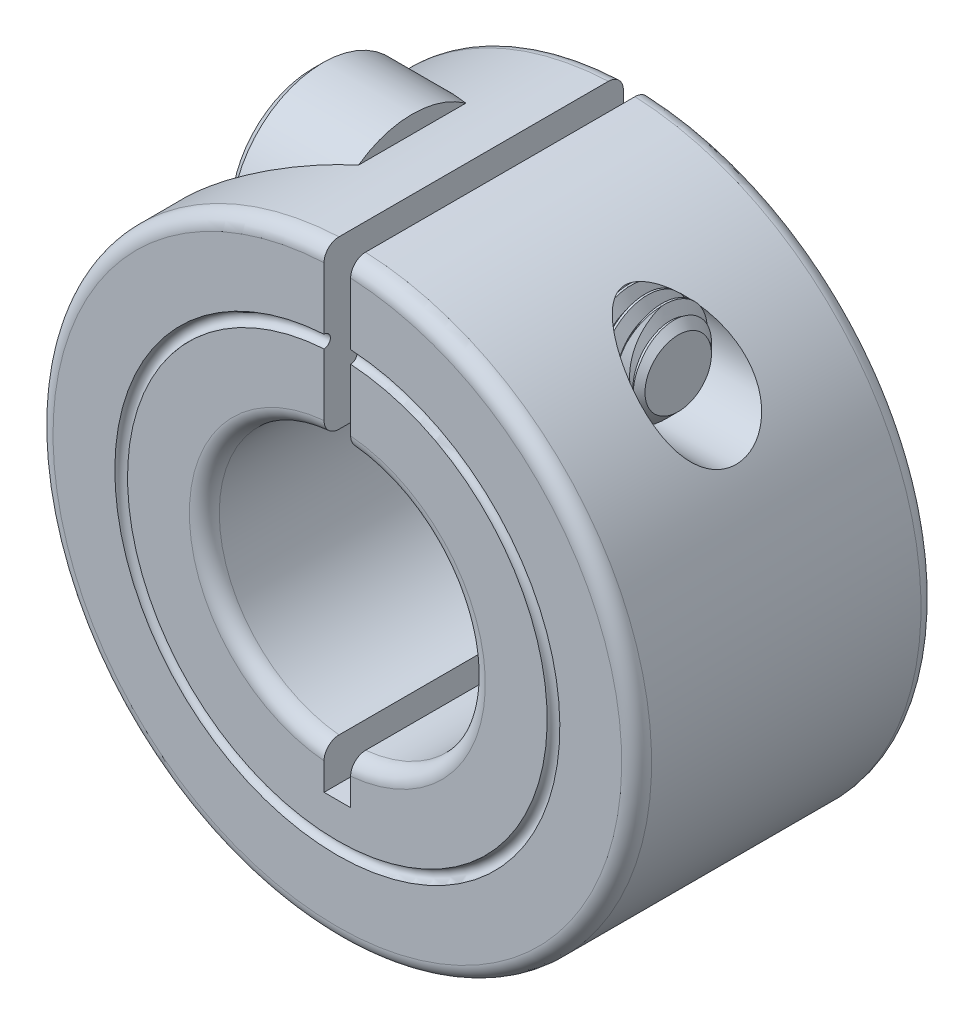
from build123d import *

# Parameters (mm, degrees)
EXTRUDE1_DEPTH     = 4.5
FILLET1_R          = 0.45
CUT_EXTRUDE1_DEPTH = 2.5
CHAMFER1_SIZE      = 0.3175
CHAMFER2_SIZE      = 0.5
CUT_SWEEP1_PITCH   = 0.5


with BuildPart() as part:
    # Sketch1 → Extrude1 (new, symmetric)
    with BuildSketch(Plane.XY):
        with BuildLine():
            Line((-0.4, 3.979949748), (-0.4, 8.991106717))
            ThreePointArc((-0.4, 8.991106717), (0, -9), (0.4, 8.991106717))
            Line((0.4, 8.991106717), (0.4, 3.979949748))
            ThreePointArc((0.4, 3.979949748), (4, 0), (0.4, -3.979949748))
            Line((0.4, -3.979949748), (0.4, -5.25))
            Line((0.4, -5.25), (-0.4, -5.25))
            Line((-0.4, -5.25), (-0.4, -3.979949748))
            ThreePointArc((-0.4, -3.979949748), (-4, 0), (-0.4, 3.979949748))
        make_face()
    extrude(amount=EXTRUDE1_DEPTH, both=True)

    # Fillet1
    fillet1_edges = [part.edges().sort_by_distance(p)[0] for p in [
        (-4, 0, 4.5),
        (0, -9, 4.5),
        (4, 0, 4.5),
        (4, 0, -4.5),
        (0, -9, -4.5),
        (-4, 0, -4.5),
    ]]
    fillet(fillet1_edges, radius=FILLET1_R)

    # Sketch2 → Cut-Revolve1 (revolve, cut)
    with BuildSketch(Plane(origin=(0, 0, 0), x_dir=(1, 0, 0), z_dir=(0, 1, 0))):
        with BuildLine():
            Line((-6.6905, -4.5), (-6.3095, -4.5))
            ThreePointArc((-6.3095, -4.5), (-6.5, -4.3095), (-6.6905, -4.5))
        make_face()
    revolve(axis=Axis((0, 0, -4.5), (0, 0, 1)), mode=Mode.SUBTRACT)

    # Sketch3 → Cut-Revolve2 (revolve, cut)
    with BuildSketch(Plane.XY, mode=Mode.PRIVATE) as cut_revolve2_sk:
        Polygon((9, 6.485528233), (-9, 6.485528233), (-9, 3.733028233), (-2.25, 3.733028233), (-2.25, 4.985528233), (9, 4.985528233), align=None)
    revolve(cut_revolve2_sk.sketch.rotate(Axis((-9, 6.485528233, 0), (-1, 0, 0)), 180), axis=Axis((-9, 6.485528233, 0), (-1, 0, 0)), mode=Mode.SUBTRACT)


with BuildPart() as body_2:
    # Sketch4 → Revolve1 (revolve)
    with BuildSketch(Plane.XY):
        Polygon((-5.25, 6.485528233), (-5.25, 9.235528233), (-2.25, 9.235528233), (-2.25, 7.985528233), (5.75, 7.985528233), (5.75, 6.485528233), align=None)
    revolve(axis=Axis((5.75, 6.485528233, 0), (-1, 0, 0)))

    # Sketch5 → Cut-Extrude1 (cut)
    with BuildSketch(Plane(origin=(-5.25, 0, 0), x_dir=(0, -1, 0), z_dir=(-1, 0, 0))):
        Polygon((-5.763840396, -1.25), (-5.04215256, 0), (-5.763840396, 1.25), (-7.207216069, 1.25), (-7.928903906, 0), (-7.207216069, -1.25), align=None)
    extrude(amount=-CUT_EXTRUDE1_DEPTH, mode=Mode.SUBTRACT)

    # Chamfer1
    chamfer1_edges = [body_2.edges().sort_by_distance(p)[0] for p in [
        (-5.25, 3.735528233, 0),
    ]]
    chamfer(chamfer1_edges, length=CHAMFER1_SIZE)

    # Chamfer2
    chamfer2_edges = [body_2.edges().sort_by_distance(p)[0] for p in [
        (5.75, 4.985528233, 0),
    ]]
    chamfer(chamfer2_edges, length=CHAMFER2_SIZE)

    # Cut-Sweep1: arcs per turn and ends read off the stored shape
    # Cut-Sweep1: the profile of Sketch7 screwed along a right-hand helix through 16 turns, 6 arcs to a turn; built about Z, then put on its axis
    cut_sweep1_z = Axis((0, 0, 0), (0, 0, 1))
    cut_sweep1_corners = [(1.175240474, -2.05e-07, -0.312500014), (1.175240474, -2.05e-07, -0.375000014), (1.527063294, -2.67e-07, -0.578125014), (1.527063294, -2.67e-07, -0.109375014)]
    with BuildLine(mode=Mode.PRIVATE) as cut_sweep1_profile:
        Line(cut_sweep1_corners[0], cut_sweep1_corners[1])
        Line(cut_sweep1_corners[1], cut_sweep1_corners[2])
        Line(cut_sweep1_corners[2], cut_sweep1_corners[3])
        Line(cut_sweep1_corners[3], cut_sweep1_corners[0])
    cut_sweep1_cap = Face(cut_sweep1_profile.wire())
    cut_sweep1_turn_angles = [0, 30, 60, 90, 120, 150, 180, 210, 240, 270, 300, 330, 360]
    cut_sweep1_turn_weights = [1, 0.8660254037844387, 1, 0.8660254037844387, 1, 0.8660254037844387, 1, 0.8660254037844387, 1, 0.8660254037844387, 1, 0.8660254037844387, 1]
    cut_sweep1_turn_rails = [Edge.make_bspline([Vector(p[0], p[1], 0).rotate(cut_sweep1_z, cut_sweep1_turn_angles[k]) / cut_sweep1_turn_weights[k] + Vector(0, 0, p[2] + CUT_SWEEP1_PITCH * cut_sweep1_turn_angles[k] / 360) for k in range(13)], [0, 0, 0, 1, 1, 2, 2, 3, 3, 4, 4, 5, 5, 6, 6, 6], 2, cut_sweep1_turn_weights) for p in cut_sweep1_corners]
    cut_sweep1_turn_sides = [Face.make_surface_from_curves(cut_sweep1_turn_rails[p[0]], cut_sweep1_turn_rails[p[1]]) for p in [(0, 1), (1, 2), (2, 3), (3, 0)]]
    cut_sweep1 = Plane(origin=(5.75, 6.485528233, 0), x_dir=(0, 0, 1), z_dir=(-1, 0, 0)) * Solid(Shell([*[p.moved(Location((0, 0, CUT_SWEEP1_PITCH * i))) for i in range(16) for p in cut_sweep1_turn_sides], cut_sweep1_cap, cut_sweep1_cap.rotate(cut_sweep1_z, 5760).moved(Location((0, 0, CUT_SWEEP1_PITCH * 5760 / 360)))]))
    add(cut_sweep1, mode=Mode.SUBTRACT)


solid = Compound([part.part, body_2.part])
